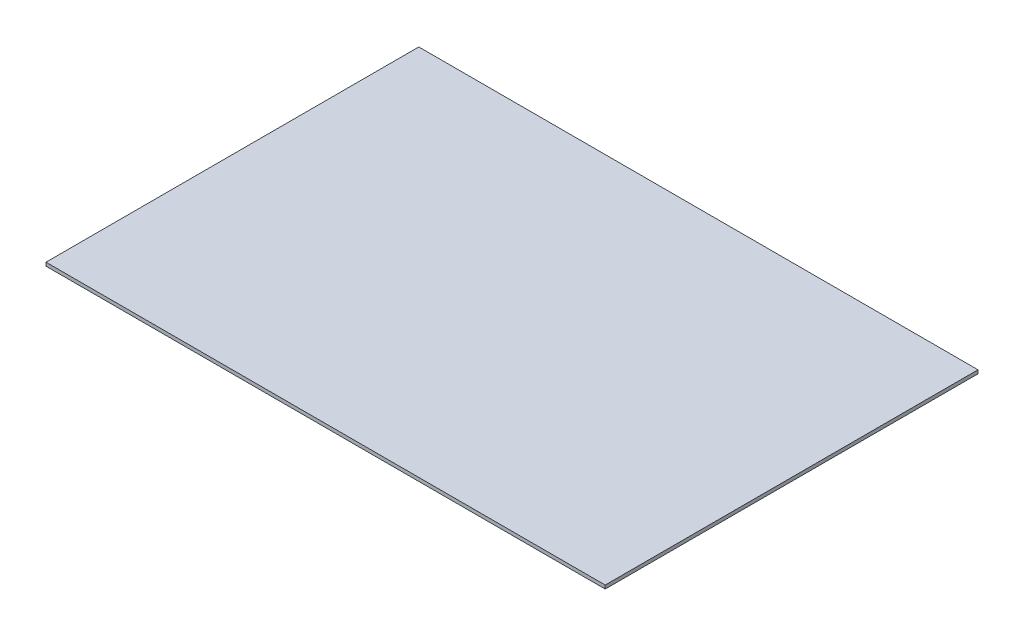
from build123d import *

# Parameters (mm, degrees)
SKETCH1_W           = 240
SKETCH1_H           = 160
BOSS_EXTRUDE1_DEPTH = 1.5


with BuildPart() as part:
    # Sketch1 → Boss-Extrude1 (new body)
    with BuildSketch(Plane(origin=(0, 0, 0), x_dir=(1, 0, 0), z_dir=(0, 1, 0))):
        Rectangle(SKETCH1_W, SKETCH1_H)
    extrude(amount=BOSS_EXTRUDE1_DEPTH)


solid = part.part
